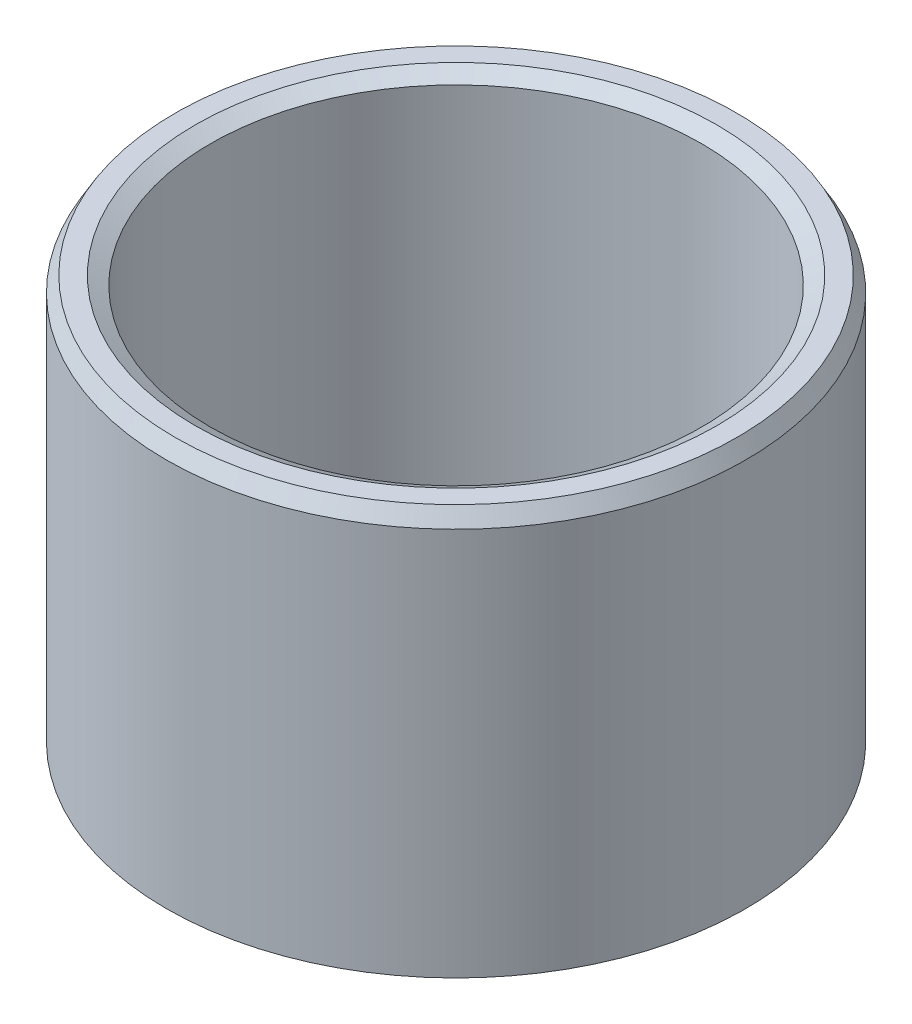
from build123d import *
from OCP.BRepFilletAPI import BRepFilletAPI_MakeChamfer

# Parameters (mm, degrees)
SKETCH1_R           = 60
BOSS_EXTRUDE1_DEPTH = 85.443949529
SKETCH2_R           = 50.86505562
CUT_EXTRUDE1_DEPTH  = 121.418721598
CHAMFER1_SIZE       = 3.137369604
CHAMFER1_SIZE2      = 1.811361185


with BuildPart() as part:
    # Sketch1 → Boss-Extrude1 (new body)
    with BuildSketch(Plane(origin=(0, 0, 0), x_dir=(1, 0, 0), z_dir=(0, 1, 0))):
        Circle(SKETCH1_R)
    extrude(amount=BOSS_EXTRUDE1_DEPTH)

    # Sketch2 → Cut-Extrude1 (cut, through all)
    with BuildSketch(Plane(origin=(0, 0, 0), x_dir=(1, 0, 0), z_dir=(0, 1, 0))):
        Circle(SKETCH2_R)
    extrude(amount=CUT_EXTRUDE1_DEPTH, mode=Mode.SUBTRACT)

    # Chamfer1: one chamfer whose edges measure the first distance from different faces: ONE call of the kernel's chamfer builder (chamfer() names one face for all edges)
    chamfer1_edges_1 = [part.edges().sort_by_distance(p)[0] for p in [
        (-50.86505562, 85.443949529, 0),
    ]]
    chamfer1_side_1 = [part.faces().sort_by_distance(p)[0] for p in [
        (-58.302943725, 85.443949529, 0),
    ]]
    chamfer1_edges_2 = [part.edges().sort_by_distance(p)[0] for p in [
        (-50.86505562, 0, 0),
    ]]
    chamfer1_side_2 = [part.faces().sort_by_distance(p)[0] for p in [
        (-50.86505562, 42.721974765, 0),
    ]]
    chamfer1_edges_3 = [part.edges().sort_by_distance(p)[0] for p in [
        (-60, 0, 0),
    ]]
    chamfer1_side_3 = [part.faces().sort_by_distance(p)[0] for p in [
        (-58.302943725, 0, 0),
    ]]
    chamfer1_edges_4 = [part.edges().sort_by_distance(p)[0] for p in [
        (-60, 85.443949529, 0),
    ]]
    chamfer1_side_4 = [part.faces().sort_by_distance(p)[0] for p in [
        (-60, 42.721974765, 0),
    ]]
    chamfer1 = BRepFilletAPI_MakeChamfer(part.part.solid().wrapped)
    for e in chamfer1_edges_1:
        chamfer1.Add(CHAMFER1_SIZE, CHAMFER1_SIZE2, e.wrapped, chamfer1_side_1[0].wrapped)  # the first distance lies on this face
    for e in chamfer1_edges_2:
        chamfer1.Add(CHAMFER1_SIZE, CHAMFER1_SIZE2, e.wrapped, chamfer1_side_2[0].wrapped)  # the first distance lies on this face
    for e in chamfer1_edges_3:
        chamfer1.Add(CHAMFER1_SIZE, CHAMFER1_SIZE2, e.wrapped, chamfer1_side_3[0].wrapped)  # the first distance lies on this face
    for e in chamfer1_edges_4:
        chamfer1.Add(CHAMFER1_SIZE, CHAMFER1_SIZE2, e.wrapped, chamfer1_side_4[0].wrapped)  # the first distance lies on this face
    add(Compound.cast(chamfer1.Shape()), mode=Mode.REPLACE)


solid = part.part
